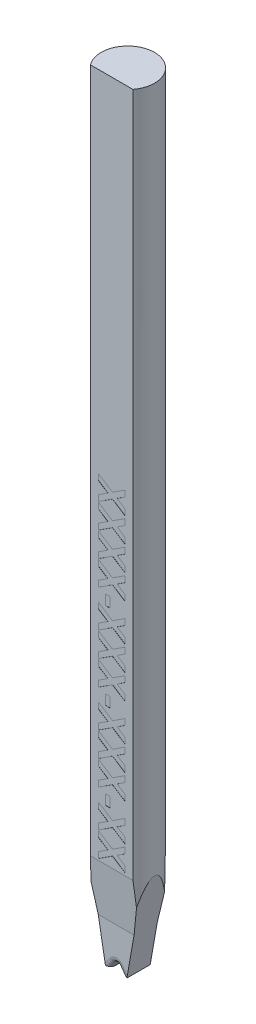
from build123d import *

# Parameters (mm, degrees)
SKETCH_TL_CUTTING_R       = 0.99695
TL_CUTTING_DEPTH          = 29.0068
SKETCH_TDF_GRINDING_W     = 2.0139
SKETCH_TDF_GRINDING_H     = 2.0139
TDF_GRINDING_DEPTH        = 30.041044486
SKETCH_ENGRAVING_W        = 0.166666667
SKETCH_ENGRAVING_H        = 0.371794872
ENGRAVING_DEPTH           = 0.005
VW_VR_GRINDING_DEPTH      = 1.00695
VW_VR_GRINDING_DEPTH_BACK = 1.00695
ISA_GRINDING_DEPTH        = 1.00695
ISA_GRINDING_DEPTH_BACK   = 1.00695
PRE_FRX_BRX_DEPTH         = 1.00695
PRE_FRX_BRX_DEPTH_BACK    = 1.00695
SKETCH_PRE_FRX_BRX_W      = 0.57134
SKETCH_PRE_FRX_BRX_H      = 1.524
FR_EDM_R                  = 0.20066
BR_EDM_R                  = 0.20066
FA_BA_GRINDING_DEPTH      = 1.00695
FA_BA_GRINDING_DEPTH_BACK = 1.00695


with BuildPart() as part:
    # sketch_TL_cutting → TL_cutting (new body)
    with BuildSketch(Plane(origin=(0, 0, 0), x_dir=(1, 0, 0), z_dir=(0, 1, 0))):
        Circle(SKETCH_TL_CUTTING_R)
    extrude(amount=TL_CUTTING_DEPTH)

    # sketch_TDF_grinding → TDF_grinding (cut, through all)
    with BuildSketch(Plane(origin=(0, 0, 0), x_dir=(1, 0, 0), z_dir=(0, 1, 0))):
        with Locations((0, -1.6102)):
            Rectangle(SKETCH_TDF_GRINDING_W, SKETCH_TDF_GRINDING_H)
    extrude(amount=TDF_GRINDING_DEPTH, mode=Mode.SUBTRACT)

    # sketch_engraving → engraving (cut)
    with BuildSketch(Plane.XY.offset(0.60325)):
        Polygon((-0.5, 15.947329744), (0.029647436, 15.604581346), (0.5, 15.908868205), (0.5, 15.68410859), (0.203325321, 15.492201538), (0.5, 15.300294487), (0.5, 15.075534872), (0.029647436, 15.379821731), (-0.5, 15.037073333), (-0.5, 15.261832949), (-0.144030449, 15.492201538), (-0.5, 15.722570128), align=None)
        Polygon((-0.5, 15.024252821), (0.029647436, 14.681504423), (0.5, 14.985791282), (0.5, 14.761031667), (0.203325321, 14.569124615), (0.5, 14.377217564), (0.5, 14.152457949), (0.029647436, 14.456744808), (-0.5, 14.11399641), (-0.5, 14.338756026), (-0.144030449, 14.569124615), (-0.5, 14.799493205), align=None)
        Polygon((-0.5, 14.101175897), (0.029647436, 13.7584275), (0.5, 14.062714359), (0.5, 13.837954744), (0.203325321, 13.646047692), (0.5, 13.454140641), (0.5, 13.229381026), (0.029647436, 13.533667885), (-0.5, 13.190919487), (-0.5, 13.415679103), (-0.144030449, 13.646047692), (-0.5, 13.876416282), align=None)
        Polygon((-0.5, 13.178098974), (0.029647436, 12.835350577), (0.5, 13.139637436), (0.5, 12.914877821), (0.203325321, 12.722970769), (0.5, 12.531063718), (0.5, 12.306304103), (0.029647436, 12.610590962), (-0.5, 12.267842564), (-0.5, 12.492602179), (-0.144030449, 12.722970769), (-0.5, 12.953339359), align=None)
        with Locations((-0.147435898, 11.998611795)):
            Rectangle(SKETCH_ENGRAVING_W, SKETCH_ENGRAVING_H)
        Polygon((-0.5, 11.79348359), (0.029647436, 11.450735192), (0.5, 11.755022051), (0.5, 11.530262436), (0.203325321, 11.338355385), (0.5, 11.146448333), (0.5, 10.921688718), (0.029647436, 11.225975577), (-0.5, 10.883227179), (-0.5, 11.107986795), (-0.144030449, 11.338355385), (-0.5, 11.568723974), align=None)
        Polygon((-0.5, 10.870406667), (0.029647436, 10.527658269), (0.5, 10.831945128), (0.5, 10.607185513), (0.203325321, 10.415278462), (0.5, 10.22337141), (0.5, 9.998611795), (0.029647436, 10.302898654), (-0.5, 9.960150256), (-0.5, 10.184909872), (-0.144030449, 10.415278462), (-0.5, 10.645647051), align=None)
        Polygon((-0.5, 9.947329744), (0.029647436, 9.604581346), (0.5, 9.908868205), (0.5, 9.68410859), (0.203325321, 9.492201538), (0.5, 9.300294487), (0.5, 9.075534872), (0.029647436, 9.379821731), (-0.5, 9.037073333), (-0.5, 9.261832949), (-0.144030449, 9.492201538), (-0.5, 9.722570128), align=None)
        with Locations((-0.147435898, 8.767842564)):
            Rectangle(SKETCH_ENGRAVING_W, SKETCH_ENGRAVING_H)
        Polygon((-0.5, 8.562714359), (0.029647436, 8.219965962), (0.5, 8.524252821), (0.5, 8.299493205), (0.203325321, 8.107586154), (0.5, 7.915679103), (0.5, 7.690919487), (0.029647436, 7.995206346), (-0.5, 7.652457949), (-0.5, 7.877217564), (-0.144030449, 8.107586154), (-0.5, 8.337954744), align=None)
        Polygon((-0.5, 7.639637436), (0.029647436, 7.296889038), (0.5, 7.601175897), (0.5, 7.376416282), (0.203325321, 7.184509231), (0.5, 6.992602179), (0.5, 6.767842564), (0.029647436, 7.072129423), (-0.5, 6.729381026), (-0.5, 6.954140641), (-0.144030449, 7.184509231), (-0.5, 7.414877821), align=None)
        Polygon((-0.5, 6.716560513), (0.029647436, 6.373812115), (0.5, 6.678098974), (0.5, 6.453339359), (0.203325321, 6.261432308), (0.5, 6.069525256), (0.5, 5.844765641), (0.029647436, 6.1490525), (-0.5, 5.806304103), (-0.5, 6.031063718), (-0.144030449, 6.261432308), (-0.5, 6.491800897), align=None)
        with Locations((-0.147435898, 5.537073333)):
            Rectangle(SKETCH_ENGRAVING_W, SKETCH_ENGRAVING_H)
        Polygon((-0.5, 5.331945128), (0.029647436, 4.989196731), (0.5, 5.29348359), (0.5, 5.068723974), (0.203325321, 4.876816923), (0.5, 4.684909872), (0.5, 4.460150256), (0.029647436, 4.764437115), (-0.5, 4.421688718), (-0.5, 4.646448333), (-0.144030449, 4.876816923), (-0.5, 5.107185513), align=None)
        Polygon((-0.5, 4.408868205), (0.029647436, 4.066119808), (0.5, 4.370406667), (0.5, 4.145647051), (0.203325321, 3.95374), (0.5, 3.761832949), (0.5, 3.537073333), (0.029647436, 3.841360192), (-0.5, 3.498611795), (-0.5, 3.72337141), (-0.144030449, 3.95374), (-0.5, 4.18410859), align=None)
    extrude(amount=-ENGRAVING_DEPTH, mode=Mode.SUBTRACT)

    # sketch_VW_VR_grinding → VW_VR_grinding (cut, two sides: drawn at the far end of the back side and taken through both)
    with BuildSketch(Plane.XY.offset(-VW_VR_GRINDING_DEPTH_BACK)):
        with BuildLine():
            Line((-0.99195, -0.01), (-0.99195, 1.509))
            ThreePointArc((-0.99195, 1.509), (-0.993414466, 1.512535534), (-0.99695, 1.514))
            Line((-0.99695, 1.514), (-1.00695, 1.514))
            Line((-1.00695, 1.514), (-1.00695, -0.01))
            Line((-1.00695, -0.01), (-0.99195, -0.01))
        make_face()
        with BuildLine():
            Line((0.99195, -0.01), (0.99195, 1.509))
            ThreePointArc((0.99195, 1.509), (0.993414466, 1.512535534), (0.99695, 1.514))
            Line((0.99695, 1.514), (1.00695, 1.514))
            Line((1.00695, 1.514), (1.00695, -0.01))
            Line((1.00695, -0.01), (0.99195, -0.01))
        make_face()
    extrude(amount=VW_VR_GRINDING_DEPTH + VW_VR_GRINDING_DEPTH_BACK, mode=Mode.SUBTRACT)

    # sketch_ISA_grinding → ISA_grinding (cut, two sides: drawn at the far end of the back side and taken through both)
    with BuildSketch(Plane.XY.offset(-ISA_GRINDING_DEPTH_BACK)):
        Polygon((-0.40005, 0), (-1.00695, 3.441900936), (-1.00695, -0.01), (1.00695, -0.01), (1.00695, 3.441900936), (0.40005, 0), align=None)
    extrude(amount=ISA_GRINDING_DEPTH + ISA_GRINDING_DEPTH_BACK, mode=Mode.SUBTRACT)

    # sketch_pre_FRX_BRX → pre_FRX_BRX (cut, two sides: drawn at the far end of the back side and taken through both)
    with BuildSketch(Plane(origin=(0, 0, 0), x_dir=(0, 0, -1), z_dir=(1, 0, 0)).offset(-PRE_FRX_BRX_DEPTH_BACK)):
        with Locations((-0.72128, 0.752)):
            Rectangle(SKETCH_PRE_FRX_BRX_W, SKETCH_PRE_FRX_BRX_H)
        with Locations((0.72128, 0.752)):
            Rectangle(SKETCH_PRE_FRX_BRX_W, SKETCH_PRE_FRX_BRX_H)
    extrude(amount=PRE_FRX_BRX_DEPTH + PRE_FRX_BRX_DEPTH_BACK, mode=Mode.SUBTRACT)

    # V-Groove_EDM: sweep along a path in sketch_contour_V-Groove
    with BuildLine(Plane(origin=(0, 0, 0), x_dir=(0, 0, -1), z_dir=(1, 0, 0))) as v_groove_edm_path:
        Line((-0.60325, 0.254), (0, 0.254))
        Line((0, 0.254), (0.99695, 0.254))
    # sketch_section_V-Groove → V-Groove_EDM (sweep, cut)
    with BuildSketch(Plane.XY.offset(0.60325)):
        with BuildLine():
            Line((-1.998237147, -2.54), (-0.065865638, 0.219712519))
            ThreePointArc((-0.065865638, 0.219712519), (0, 0.254), (0.065865638, 0.219712519))
            Line((0.065865638, 0.219712519), (1.998237147, -2.54))
            Line((1.998237147, -2.54), (-1.998237147, -2.54))
        make_face()
    sweep(path=v_groove_edm_path.line, mode=Mode.SUBTRACT)

    # FR_EDM
    fr_edm_edges = [part.edges().sort_by_distance(p)[0] for p in [
        (0.142787819, 0.10985626, 0.43561),
        (0, 0.254, 0.43561),
        (-0.142787819, 0.10985626, 0.43561),
    ]]
    fillet(fr_edm_edges, radius=FR_EDM_R)

    # BR_EDM
    br_edm_edges = [part.edges().sort_by_distance(p)[0] for p in [
        (0.142787819, 0.10985626, -0.43561),
        (0, 0.254, -0.43561),
        (-0.142787819, 0.10985626, -0.43561),
    ]]
    fillet(br_edm_edges, radius=BR_EDM_R)

    # sketch_FA_BA_grinding → FA_BA_grinding (cut, two sides: drawn at the far end of the back side and taken through both)
    with BuildSketch(Plane(origin=(0, 0, 0), x_dir=(0, 0, -1), z_dir=(1, 0, 0)).offset(-FA_BA_GRINDING_DEPTH_BACK)):
        Polygon((1.99695, 19.370197862), (1.99695, -0.1), (0.43561, -0.1), (0.43561, 1.524), align=None)
        Polygon((-2.281582645, 22.623563881), (-0.43561, 1.524), (-0.43561, -0.1), (-2.281582645, -0.1), align=None)
    extrude(amount=FA_BA_GRINDING_DEPTH + FA_BA_GRINDING_DEPTH_BACK, mode=Mode.SUBTRACT)


solid = part.part
